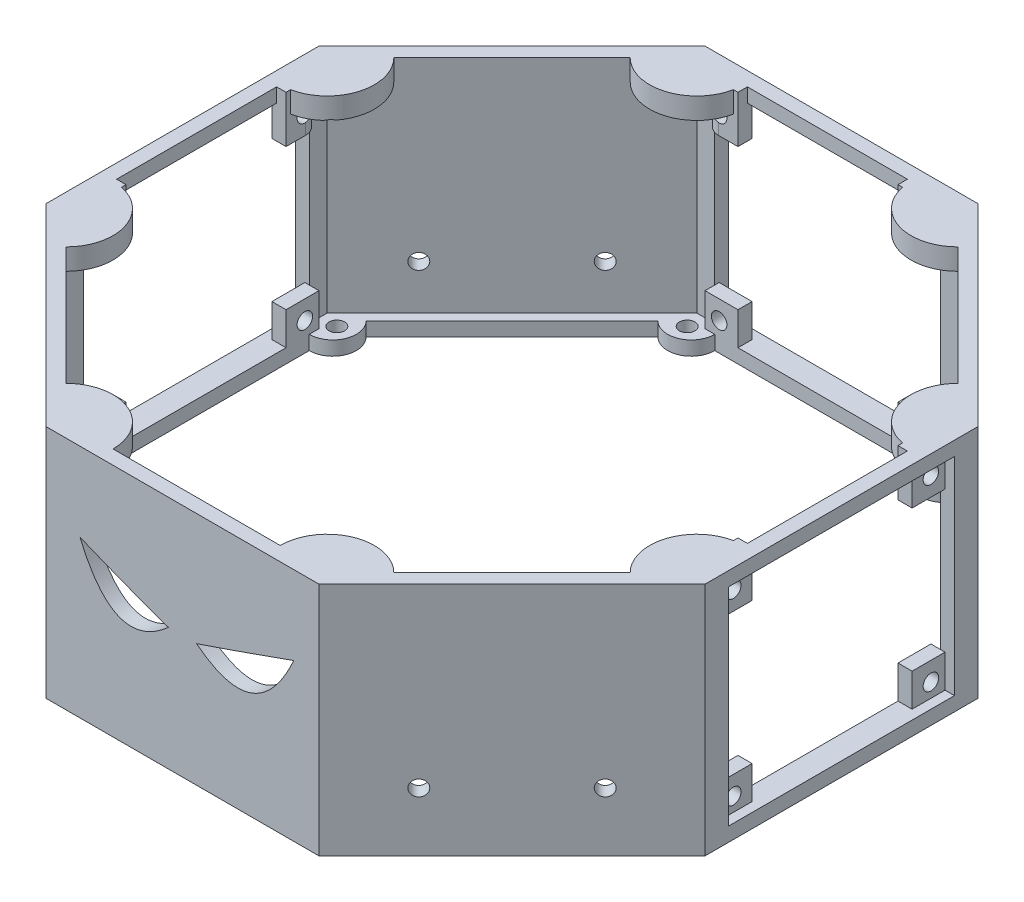
from build123d import *

# Parameters (mm, degrees)
RESSALTO_EXTRUS_O1_DEPTH    = 25
CORTE_EXTRUS_O2_DEPTH       = 111.905365064
ESBO_O14_R                  = 1.65
CORTE_EXTRUS_O6_DEPTH       = 171.834109332
ESBO_O15_R                  = 1.65
CORTE_EXTRUS_O7_DEPTH       = 171.834109332
CORTE_EXTRUS_O5_DEPTH       = 10
RESSALTO_EXTRUS_O4_DEPTH    = 3
ESBO_O18_W                  = 47.989898732
ESBO_O18_H                  = 44
CORTE_EXTRUS_O8_DEPTH       = 159.508674901
CORTE_EXTRUS_O9_REACH       = 160.509
ESBO_O19_W                  = 47.989898732
ESBO_O19_H                  = 44
RESSALTO_EXTRUS_O3_DEPTH    = 4.5
CORTE_EXTRUS_O10_START      = -4.5
ESBO_O23_R                  = 4
CORTE_EXTRUS_O10_DEPTH      = 1.8
CORTE_EXTRUS_O12_REACH      = 112.905
ESBO_O25_R                  = 1.65
ESBO_O31_W                  = 7
ESBO_O31_H                  = 10
ESBO_O31_H_2                = 7
RESSALTO_EXTRUS_O11_DEPTH   = 3
FILETE1_START               = 15
FILETE1_DEPTH               = 5.5
FILETE1_START_2             = 20.5
FILETE1_2_DEPTH             = 1.8
ESBO_O34_W                  = 7
ESBO_O34_H                  = 7
ESBO_O34_H_2                = 10
RESSALTO_EXTRUS_O12_DEPTH   = 3
CORTE_EXTRUS_O13_DEPTH      = 157.74501593
CORTE_EXTRUS_O13_DEPTH_BACK = 157.74501593
ESBO_O33_R                  = 1.65
ESBO_O35_W                  = 7
ESBO_O35_H                  = 10
ESBO_O35_H_2                = 7
RESSALTO_EXTRUS_O13_DEPTH   = 3
FILETE2_START               = 15
FILETE2_DEPTH               = 5.5
FILETE2_START_2             = 20.5
FILETE2_2_DEPTH             = 1.8
ESBO_O36_R                  = 1.65
CORTE_EXTRUS_O14_DEPTH      = 3


with BuildPart() as part:
    # Esboço1 → Ressalto-extrusão1 (new, symmetric)
    with BuildSketch(Plane(origin=(0, 0, 0), x_dir=(1, 0, 0), z_dir=(0, 1, 0))):
        Polygon((70, -28.994949366), (70, 28.994949366), (28.994949366, 70), (-28.994949366, 70), (-70, 28.994949366), (-70, -28.994949366), (-28.994949366, -70), (28.994949366, -70), align=None)
    extrude(amount=RESSALTO_EXTRUS_O1_DEPTH, both=True)

    # Esboço2 → Corte-extrusão2 (cut, through all)
    with BuildSketch(Plane(origin=(0, 25, 0), x_dir=(1, 0, 0), z_dir=(0, 1, 0))):
        Polygon((67, 27.752308679), (27.752308679, 67), (-27.752308679, 67), (-67, 27.752308679), (-67, -27.752308679), (-27.752308679, -67), (27.752308679, -67), (67, -27.752308679), align=None)
    extrude(amount=-CORTE_EXTRUS_O2_DEPTH, mode=Mode.SUBTRACT)

    # Esboço14 → Corte-extrusão6 (cut, through all)
    with BuildSketch(Plane(origin=(-49.497474683, 0, 49.497474683), x_dir=(0.7071067811865474, 0, 0.7071067811865477), z_dir=(-0.7071067811865477, 0, 0.7071067811865474))):
        with Locations((-14, -12.5)):
            Circle(ESBO_O14_R)
        with Locations((14, -12.5)):
            Circle(ESBO_O14_R)
    extrude(amount=-CORTE_EXTRUS_O6_DEPTH, mode=Mode.SUBTRACT)

    # Esboço15 → Corte-extrusão7 (cut, through all)
    with BuildSketch(Plane(origin=(-49.497474683, 0, -49.497474683), x_dir=(-0.7071067811865478, 0, 0.7071067811865472), z_dir=(-0.7071067811865472, 0, -0.7071067811865478))):
        with Locations((-14, -12.5)):
            Circle(ESBO_O15_R)
        with Locations((14, -12.5)):
            Circle(ESBO_O15_R)
    extrude(amount=-CORTE_EXTRUS_O7_DEPTH, mode=Mode.SUBTRACT)

    # Esboço13 → Corte-extrusão5 (cut)
    with BuildSketch(Plane.XY.offset(70)):
        with BuildLine():
            add(Edge.make_bspline(
                [(-21.788847985, 8.259852815), (-8.683418058, 2.910094751), (-3, 1.056973227)],
                knots=[0, 0, 0, 1, 1, 1], degree=2))
            add(Edge.make_bspline(
                [(-21.788847985, 8.259852815), (-14.438477082, -9.154872986), (-3, 1.056973227)],
                knots=[0, 0, 0, 1, 1, 1], degree=2))
        make_face()
        with BuildLine():
            add(Edge.make_bspline(
                [(23.630290503, 8.259852815), (8.683418058, 2.910094751), (3, 1.056973227)],
                knots=[0, 0, 0, 1, 1, 1], degree=2))
            add(Edge.make_bspline(
                [(23.630290503, 8.259852815), (15.797641243, -9.117856111), (3, 1.056973227)],
                knots=[0, 0, 0, 1, 1, 1], degree=2))
        make_face()
    extrude(amount=-CORTE_EXTRUS_O5_DEPTH, mode=Mode.SUBTRACT)

    # Esboço24 → Ressalto-extrusão4 (add)
    with BuildSketch(Plane.XZ.offset(25)):
        Polygon((27.752308679, -67), (67, -27.752308679), (67, 27.752308679), (27.752308679, 67), (-27.752308679, 67), (-67, 27.752308679), (-67, -27.752308679), (-27.752308679, -67), align=None)
        with BuildLine():
            ThreePointArc((-30.45941546, 61.464466094), (-25.010464392, 60.380602337), (-21.923881554, 65))
            Line((-21.923881554, 65), (21.923881554, 65))
            ThreePointArc((21.923881554, 65), (25.010464392, 60.380602337), (30.45941546, 61.464466094))
            Line((30.45941546, 61.464466094), (61.464466094, 30.45941546))
            ThreePointArc((61.464466094, 30.45941546), (60.380602337, 25.010464392), (65, 21.923881554))
            Line((65, 21.923881554), (65, -21.923881554))
            ThreePointArc((65, -21.923881554), (60.380602337, -25.010464392), (61.464466094, -30.45941546))
            Line((61.464466094, -30.45941546), (30.45941546, -61.464466094))
            ThreePointArc((30.45941546, -61.464466094), (25.010464392, -60.380602337), (21.923881554, -65))
            Line((21.923881554, -65), (-21.923881554, -65))
            ThreePointArc((-21.923881554, -65), (-25.010464392, -60.380602337), (-30.45941546, -61.464466094))
            Line((-30.45941546, -61.464466094), (-61.464466094, -30.45941546))
            ThreePointArc((-61.464466094, -30.45941546), (-60.380602337, -25.010464392), (-65, -21.923881554))
            Line((-65, -21.923881554), (-65, 21.923881554))
            ThreePointArc((-65, 21.923881554), (-60.380602337, 25.010464392), (-61.464466094, 30.45941546))
            Line((-61.464466094, 30.45941546), (-30.45941546, 61.464466094))
        make_face(mode=Mode.SUBTRACT)
    extrude(amount=-RESSALTO_EXTRUS_O4_DEPTH)

    # Esboço18 → Corte-extrusão8 (cut, through all)
    with BuildSketch(Plane.ZY.offset(70)):
        Rectangle(ESBO_O18_W, ESBO_O18_H)
    extrude(amount=-CORTE_EXTRUS_O8_DEPTH, mode=Mode.SUBTRACT)

    # Esboço19 → Corte-extrusão9 (cut, up to next)
    with BuildSketch(Plane(origin=(0, 0, -70), x_dir=(-1, 0, 0), z_dir=(0, 0, -1)), mode=Mode.PRIVATE) as corte_extrus_o9_sk1:
        Rectangle(ESBO_O19_W, ESBO_O19_H)
    corte_extrus_o9_tool1 = extrude(corte_extrus_o9_sk1.sketch, amount=-CORTE_EXTRUS_O9_REACH, mode=Mode.PRIVATE) & part.part
    add(corte_extrus_o9_tool1.solids().sort_by_distance((0, 0, -70))[0], mode=Mode.SUBTRACT)

    # Esboço22 → Ressalto-extrusão3 (add)
    with BuildSketch(Plane(origin=(0, 25, 0), x_dir=(1, 0, 0), z_dir=(0, 1, 0))):
        with BuildLine():
            Line((-27.752308679, 67), (-34.823376491, 59.928932188))
            ThreePointArc((-34.823376491, 59.928932188), (-23.925474355, 57.761204675), (-17.752308679, 67))
            Line((-17.752308679, 67), (-27.752308679, 67))
        make_face()
        with BuildLine():
            Line((59.928932188, 34.823376491), (67, 27.752308679))
            Line((67, 27.752308679), (67, 17.752308679))
            ThreePointArc((67, 17.752308679), (57.761204675, 23.925474355), (59.928932188, 34.823376491))
        make_face()
        with BuildLine():
            Line((67, -17.752308679), (67, -27.752308679))
            Line((67, -27.752308679), (59.928932188, -34.823376491))
            ThreePointArc((59.928932188, -34.823376491), (57.761204675, -23.925474355), (67, -17.752308679))
        make_face()
        with BuildLine():
            Line((-59.928932188, -34.823376491), (-67, -27.752308679))
            Line((-67, -27.752308679), (-67, -17.752308679))
            ThreePointArc((-67, -17.752308679), (-57.761204675, -23.925474355), (-59.928932188, -34.823376491))
        make_face()
        with BuildLine():
            Line((-67, 17.752308679), (-67, 27.752308679))
            Line((-67, 27.752308679), (-59.928932188, 34.823376491))
            ThreePointArc((-59.928932188, 34.823376491), (-57.761204675, 23.925474355), (-67, 17.752308679))
        make_face()
        with BuildLine():
            Line((27.752308679, 67), (17.752308679, 67))
            ThreePointArc((17.752308679, 67), (23.925474355, 57.761204675), (34.823376491, 59.928932188))
            Line((34.823376491, 59.928932188), (27.752308679, 67))
        make_face()
        with BuildLine():
            Line((-27.752308679, -67), (-17.752308679, -67))
            ThreePointArc((-17.752308679, -67), (-23.925474355, -57.761204675), (-34.823376491, -59.928932188))
            Line((-34.823376491, -59.928932188), (-27.752308679, -67))
        make_face()
        with BuildLine():
            Line((27.752308679, -67), (34.823376491, -59.928932188))
            ThreePointArc((34.823376491, -59.928932188), (23.925474355, -57.761204675), (17.752308679, -67))
            Line((17.752308679, -67), (27.752308679, -67))
        make_face()
    extrude(amount=-RESSALTO_EXTRUS_O3_DEPTH)

    # Esboço23 → Corte-extrusão10 (cut)
    with BuildSketch(Plane(origin=(0, 25, 0), x_dir=(1, 0, 0), z_dir=(0, 1, 0)).offset(CORTE_EXTRUS_O10_START)):
        with Locations(Location((-62.60896374, 25.933481907, 0), (0, 0, 90))):
            Circle(ESBO_O23_R)
        with Locations(Location((62.60896374, 25.933481907, 0), (0, 0, 90))):
            Circle(ESBO_O23_R)
        with Locations(Location((62.60896374, -25.933481907, 0), (0, 0, 90))):
            Circle(ESBO_O23_R)
        with Locations(Location((-62.60896374, -25.933481907, 0), (0, 0, 90))):
            Circle(ESBO_O23_R)
        with Locations(Location((-25.933481907, 62.60896374, 0), (0, 0, 90))):
            Circle(ESBO_O23_R)
        with Locations(Location((25.933481907, 62.60896374, 0), (0, 0, 90))):
            Circle(ESBO_O23_R)
        with Locations(Location((25.933481907, -62.60896374, 0), (0, 0, 90))):
            Circle(ESBO_O23_R)
        with Locations(Location((-25.933481907, -62.60896374, 0), (0, 0, 90))):
            Circle(ESBO_O23_R)
    extrude(amount=CORTE_EXTRUS_O10_DEPTH, mode=Mode.SUBTRACT)

    # Esboço25 → Corte-extrusão12 (cut, up to next)
    with BuildSketch(Plane.XZ.offset(25), mode=Mode.PRIVATE) as corte_extrus_o12_sk1:
        with Locations(Location((-26.31616534, 63.532843272, 0), (0, 0, 270))):
            Circle(ESBO_O25_R)
    corte_extrus_o12_tool1 = extrude(corte_extrus_o12_sk1.sketch, amount=-CORTE_EXTRUS_O12_REACH, mode=Mode.PRIVATE) & part.part
    # Esboço25 → Corte-extrusão12 (cut, up to next)
    with BuildSketch(Plane.XZ.offset(25), mode=Mode.PRIVATE) as corte_extrus_o12_sk2:
        with Locations(Location((26.31616534, 63.532843272, 0), (0, 0, 270))):
            Circle(ESBO_O25_R)
    corte_extrus_o12_tool2 = extrude(corte_extrus_o12_sk2.sketch, amount=-CORTE_EXTRUS_O12_REACH, mode=Mode.PRIVATE) & part.part
    # Esboço25 → Corte-extrusão12 (cut, up to next)
    with BuildSketch(Plane.XZ.offset(25), mode=Mode.PRIVATE) as corte_extrus_o12_sk3:
        with Locations(Location((63.532843272, 26.31616534, 0), (0, 0, 270))):
            Circle(ESBO_O25_R)
    corte_extrus_o12_tool3 = extrude(corte_extrus_o12_sk3.sketch, amount=-CORTE_EXTRUS_O12_REACH, mode=Mode.PRIVATE) & part.part
    # Esboço25 → Corte-extrusão12 (cut, up to next)
    with BuildSketch(Plane.XZ.offset(25), mode=Mode.PRIVATE) as corte_extrus_o12_sk4:
        with Locations(Location((63.532843272, -26.31616534, 0), (0, 0, 270))):
            Circle(ESBO_O25_R)
    corte_extrus_o12_tool4 = extrude(corte_extrus_o12_sk4.sketch, amount=-CORTE_EXTRUS_O12_REACH, mode=Mode.PRIVATE) & part.part
    # Esboço25 → Corte-extrusão12 (cut, up to next)
    with BuildSketch(Plane.XZ.offset(25), mode=Mode.PRIVATE) as corte_extrus_o12_sk5:
        with Locations(Location((26.31616534, -63.532843272, 0), (0, 0, 270))):
            Circle(ESBO_O25_R)
    corte_extrus_o12_tool5 = extrude(corte_extrus_o12_sk5.sketch, amount=-CORTE_EXTRUS_O12_REACH, mode=Mode.PRIVATE) & part.part
    # Esboço25 → Corte-extrusão12 (cut, up to next)
    with BuildSketch(Plane.XZ.offset(25), mode=Mode.PRIVATE) as corte_extrus_o12_sk6:
        with Locations(Location((-26.31616534, -63.532843272, 0), (0, 0, 270))):
            Circle(ESBO_O25_R)
    corte_extrus_o12_tool6 = extrude(corte_extrus_o12_sk6.sketch, amount=-CORTE_EXTRUS_O12_REACH, mode=Mode.PRIVATE) & part.part
    # Esboço25 → Corte-extrusão12 (cut, up to next)
    with BuildSketch(Plane.XZ.offset(25), mode=Mode.PRIVATE) as corte_extrus_o12_sk7:
        with Locations(Location((-63.532843272, -26.31616534, 0), (0, 0, 270))):
            Circle(ESBO_O25_R)
    corte_extrus_o12_tool7 = extrude(corte_extrus_o12_sk7.sketch, amount=-CORTE_EXTRUS_O12_REACH, mode=Mode.PRIVATE) & part.part
    # Esboço25 → Corte-extrusão12 (cut, up to next)
    with BuildSketch(Plane.XZ.offset(25), mode=Mode.PRIVATE) as corte_extrus_o12_sk8:
        with Locations(Location((-63.532843272, 26.31616534, 0), (0, 0, 270))):
            Circle(ESBO_O25_R)
    corte_extrus_o12_tool8 = extrude(corte_extrus_o12_sk8.sketch, amount=-CORTE_EXTRUS_O12_REACH, mode=Mode.PRIVATE) & part.part
    add(corte_extrus_o12_tool1.solids().sort_by_distance((-26.316165, -25, 63.532843))[0], mode=Mode.SUBTRACT)
    add(corte_extrus_o12_tool2.solids().sort_by_distance((26.316165, -25, 63.532843))[0], mode=Mode.SUBTRACT)
    add(corte_extrus_o12_tool3.solids().sort_by_distance((63.532843, -25, 26.316165))[0], mode=Mode.SUBTRACT)
    add(corte_extrus_o12_tool4.solids().sort_by_distance((63.532843, -25, -26.316165))[0], mode=Mode.SUBTRACT)
    add(corte_extrus_o12_tool5.solids().sort_by_distance((26.316165, -25, -63.532843))[0], mode=Mode.SUBTRACT)
    add(corte_extrus_o12_tool6.solids().sort_by_distance((-26.316165, -25, -63.532843))[0], mode=Mode.SUBTRACT)
    add(corte_extrus_o12_tool7.solids().sort_by_distance((-63.532843, -25, -26.316165))[0], mode=Mode.SUBTRACT)
    add(corte_extrus_o12_tool8.solids().sort_by_distance((-63.532843, -25, 26.316165))[0], mode=Mode.SUBTRACT)

    # Esboço31 → Ressalto-extrusão11 (add)
    with BuildSketch(Plane.ZY.offset(-65)):
        with Locations((20.494949366, 20)):
            Rectangle(ESBO_O31_W, ESBO_O31_H)
        with Locations((-20.494949366, 20)):
            Rectangle(ESBO_O31_W, ESBO_O31_H)
        with Locations((-20.494949366, -18.5)):
            Rectangle(ESBO_O31_W, ESBO_O31_H_2)
        with Locations((20.494949366, -18.5)):
            Rectangle(ESBO_O31_W, ESBO_O31_H_2)
    extrude(amount=-RESSALTO_EXTRUS_O11_DEPTH)

    # Filete1: read off the stored shape, not the designer's step
    # Filete1 outline → Filete1 (cut)
    with BuildSketch(Plane(origin=(0, 0, 0), x_dir=(1, 0, 0), z_dir=(0, 1, 0)).offset(FILETE1_START)):
        with BuildLine():
            Line((65, -23.994949366), (67, -23.994949366))
            ThreePointArc((67, -23.994949366), (65.550510257, -22.898573049), (65, -21.166522241))
            Line((65, -21.166522241), (65, -23.994949366))
        make_face()
        with BuildLine():
            ThreePointArc((65, 21.166522241), (65.550510257, 22.898573049), (67, 23.994949366))
            Line((67, 23.994949366), (65, 23.994949366))
            Line((65, 23.994949366), (65, 21.166522241))
        make_face()
    extrude(amount=FILETE1_DEPTH, mode=Mode.SUBTRACT)

    # Filete1 2 outline → Filete1 2 (cut)
    with BuildSketch(Plane(origin=(0, 0, 0), x_dir=(1, 0, 0), z_dir=(0, 1, 0)).offset(FILETE1_START_2)):
        with BuildLine():
            Line((65, -23.994949366), (66.107833784, -23.994949366))
            ThreePointArc((66.107833784, -23.994949366), (65.621406817, -23.301906959), (65, -22.726778678))
            Line((65, -22.726778678), (65, -23.994949366))
        make_face()
        with BuildLine():
            Line((65, 23.994949366), (65, 22.726778678))
            ThreePointArc((65, 22.726778678), (65.621406817, 23.301906959), (66.107833784, 23.994949366))
            Line((66.107833784, 23.994949366), (65, 23.994949366))
        make_face()
    extrude(amount=FILETE1_2_DEPTH, mode=Mode.SUBTRACT)

    # Esboço34 → Ressalto-extrusão12 (add)
    with BuildSketch(Plane(origin=(-65, 0, 0), x_dir=(0, 0, -1), z_dir=(1, 0, 0))):
        with Locations((-20.494949366, -18.5)):
            Rectangle(ESBO_O34_W, ESBO_O34_H)
        with Locations((-20.494949366, 20)):
            Rectangle(ESBO_O34_W, ESBO_O34_H_2)
        with Locations((20.494949366, 20)):
            Rectangle(ESBO_O34_W, ESBO_O34_H_2)
        with Locations((20.494949366, -18.5)):
            Rectangle(ESBO_O34_W, ESBO_O34_H)
    extrude(amount=-RESSALTO_EXTRUS_O12_DEPTH)

    # Esboço33 → Corte-extrusão13 (cut, two sides: drawn at the far end of the back side and taken through both)
    with BuildSketch(Plane(origin=(68, 0, 0), x_dir=(0, 0, -1), z_dir=(1, 0, 0)).offset(-CORTE_EXTRUS_O13_DEPTH_BACK)):
        with Locations(Location((-20.994949366, 19, 0), (0, 0, 65.380022671))):
            Circle(ESBO_O33_R)
        with Locations(Location((20.994949366, 19, 0), (0, 0, 65.380022671))):
            Circle(ESBO_O33_R)
        with Locations(Location((20.994949366, -19, 0), (0, 0, 180))):
            Circle(ESBO_O33_R)
        with Locations(Location((-20.994949366, -19, 0), (0, 0, 180))):
            Circle(ESBO_O33_R)
    extrude(amount=CORTE_EXTRUS_O13_DEPTH + CORTE_EXTRUS_O13_DEPTH_BACK, mode=Mode.SUBTRACT)

    # Esboço35 → Ressalto-extrusão13 (add)
    with BuildSketch(Plane.XY.offset(-65)):
        with Locations((-20.494949366, 20)):
            Rectangle(ESBO_O35_W, ESBO_O35_H)
        with Locations((20.494949366, 20)):
            Rectangle(ESBO_O35_W, ESBO_O35_H)
        with Locations((20.494949366, -18.5)):
            Rectangle(ESBO_O35_W, ESBO_O35_H_2)
        with Locations((-20.494949366, -18.5)):
            Rectangle(ESBO_O35_W, ESBO_O35_H_2)
    extrude(amount=-RESSALTO_EXTRUS_O13_DEPTH)

    # Filete2: read off the stored shape, not the designer's step
    # Filete2 outline → Filete2 (cut)
    with BuildSketch(Plane(origin=(0, 0, 0), x_dir=(1, 0, 0), z_dir=(0, 1, 0)).offset(FILETE2_START)):
        with BuildLine():
            Line((-23.994949366, 65), (-21.166522241, 65))
            ThreePointArc((-21.166522241, 65), (-22.898573049, 65.550510257), (-23.994949366, 67))
            Line((-23.994949366, 67), (-23.994949366, 65))
        make_face()
        with BuildLine():
            Line((23.994949366, 65), (23.994949366, 67))
            ThreePointArc((23.994949366, 67), (22.898573049, 65.550510257), (21.166522241, 65))
            Line((21.166522241, 65), (23.994949366, 65))
        make_face()
        with BuildLine():
            ThreePointArc((-65, -21.166522241), (-65.550510257, -22.898573049), (-67, -23.994949366))
            Line((-67, -23.994949366), (-65, -23.994949366))
            Line((-65, -23.994949366), (-65, -21.166522241))
        make_face()
        with BuildLine():
            ThreePointArc((-67, 23.994949366), (-65.550510257, 22.898573049), (-65, 21.166522241))
            Line((-65, 21.166522241), (-65, 23.994949366))
            Line((-65, 23.994949366), (-67, 23.994949366))
        make_face()
    extrude(amount=FILETE2_DEPTH, mode=Mode.SUBTRACT)

    # Filete2 2 outline → Filete2 2 (cut)
    with BuildSketch(Plane(origin=(0, 0, 0), x_dir=(1, 0, 0), z_dir=(0, 1, 0)).offset(FILETE2_START_2)):
        with BuildLine():
            Line((-23.994949366, 65), (-22.726778678, 65))
            ThreePointArc((-22.726778678, 65), (-23.301906959, 65.621406817), (-23.994949366, 66.107833784))
            Line((-23.994949366, 66.107833784), (-23.994949366, 65))
        make_face()
        with BuildLine():
            Line((23.994949366, 65), (23.994949366, 66.107833784))
            ThreePointArc((23.994949366, 66.107833784), (23.301906959, 65.621406817), (22.726778678, 65))
            Line((22.726778678, 65), (23.994949366, 65))
        make_face()
        with BuildLine():
            Line((-65, -23.994949366), (-65, -22.726778678))
            ThreePointArc((-65, -22.726778678), (-65.621406817, -23.301906959), (-66.107833784, -23.994949366))
            Line((-66.107833784, -23.994949366), (-65, -23.994949366))
        make_face()
        with BuildLine():
            ThreePointArc((-66.107833784, 23.994949366), (-65.621406817, 23.301906959), (-65, 22.726778678))
            Line((-65, 22.726778678), (-65, 23.994949366))
            Line((-65, 23.994949366), (-66.107833784, 23.994949366))
        make_face()
    extrude(amount=FILETE2_2_DEPTH, mode=Mode.SUBTRACT)

    # Esboço36 → Corte-extrusão14 (cut)
    with BuildSketch(Plane.XY.offset(-65)):
        with Locations((20.994949366, -19)):
            Circle(ESBO_O36_R)
        with Locations((-20.994949366, -19)):
            Circle(ESBO_O36_R)
        with Locations((-20.994949366, 19)):
            Circle(ESBO_O36_R)
        with Locations((20.994949366, 19)):
            Circle(ESBO_O36_R)
    extrude(amount=-CORTE_EXTRUS_O14_DEPTH, mode=Mode.SUBTRACT)


solid = part.part
